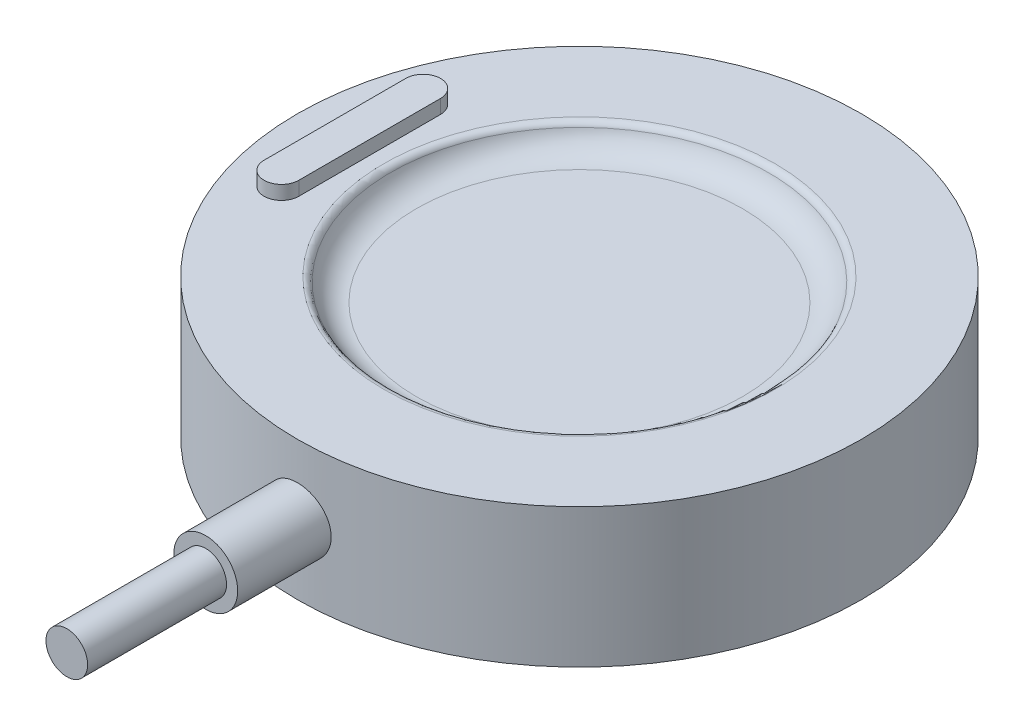
from build123d import *

# Parameters (mm, degrees)
SKETCH_1_R          = 20.3
EXTRUDE_1_DEPTH     = 10
SKETCH_2_R          = 2.3
EXTRUDE_2_DEPTH     = 26.9
SKETCH_3_R          = 1.5
EXTRUDE_3_DEPTH     = 10
EXTRUDE_4_DEPTH     = 1
SKETCH_5_R          = 13.7
CUT_EXTRUDE_1_DEPTH = 1.63
FILLET_1_R          = 2
FILLET_2_R          = 0.5


with BuildPart() as part:
    # 草图1 → 凸台-拉伸1 (new body)
    with BuildSketch(Plane(origin=(0, 0, 0), x_dir=(1, 0, 0), z_dir=(0, 1, 0))):
        with Locations(Location((0, 0, 0), (0, 0, 270))):
            Circle(SKETCH_1_R)
    extrude(amount=EXTRUDE_1_DEPTH)

    # 草图2 → 凸台-拉伸2 (add)
    with BuildSketch(Plane.XY):
        with Locations(Location((0, 5, 0), (0, 0, 180))):
            Circle(SKETCH_2_R)
    extrude(amount=EXTRUDE_2_DEPTH)

    # 草图3 → 凸台-拉伸3 (add)
    with BuildSketch(Plane.XY.offset(26.9)):
        with Locations((0, 5)):
            Circle(SKETCH_3_R)
    extrude(amount=EXTRUDE_3_DEPTH)

    # 草图4 → 凸台-拉伸4 (add)
    with BuildSketch(Plane(origin=(0, 10, 0), x_dir=(1, 0, 0), z_dir=(0, 1, 0))):
        with BuildLine():
            Line((-15.1, 5.1), (-15.1, -5.1))
            ThreePointArc((-15.1, -5.1), (-16.35, -6.35), (-17.6, -5.1))
            Line((-17.6, -5.1), (-17.6, 5.1))
            ThreePointArc((-17.6, 5.1), (-16.35, 6.35), (-15.1, 5.1))
        make_face()
    extrude(amount=EXTRUDE_4_DEPTH)

    # 草图5 → 切除-拉伸1 (cut)
    with BuildSketch(Plane(origin=(0, 10, 0), x_dir=(1, 0, 0), z_dir=(0, 1, 0))):
        with Locations(Location((0, 0, 0), (0, 0, 270))):
            Circle(SKETCH_5_R)
    extrude(amount=-CUT_EXTRUDE_1_DEPTH, mode=Mode.SUBTRACT)

    # 圆角1
    # the kernel refuses this fillet: 2 mm, written as the material it adds along each edge
    with BuildSketch(Plane(origin=(0, 8.37, 0), x_dir=(0, 0, 1), z_dir=(-1, 0, 0))) as fillet_1_piece_1:
        with BuildLine():
            CenterArc((11.734522959, 2), FILLET_1_R, 270, 79.338867602)
            Line((11.734522959, 0), (11.734522959, -0.04))
            Line((11.734522959, -0.04), (13.7, -0.04))
            Line((13.7, -0.04), (13.74, 0))
            ThreePointArc((13.74, 0), (13.74, 0.815), (13.739309541, 1.6226))
            Line((13.739309541, 1.6226), (13.7, 1.63))
        make_face()
    revolve(axis=Axis((0, 8.37, 0), (0, 1, 0)))

    # 圆角2
    fillet_2_edges = [part.edges().sort_by_distance(p)[0] for p in [
        (0, 10, -13.7),
    ]]
    fillet(fillet_2_edges, radius=FILLET_2_R)


solid = part.part
